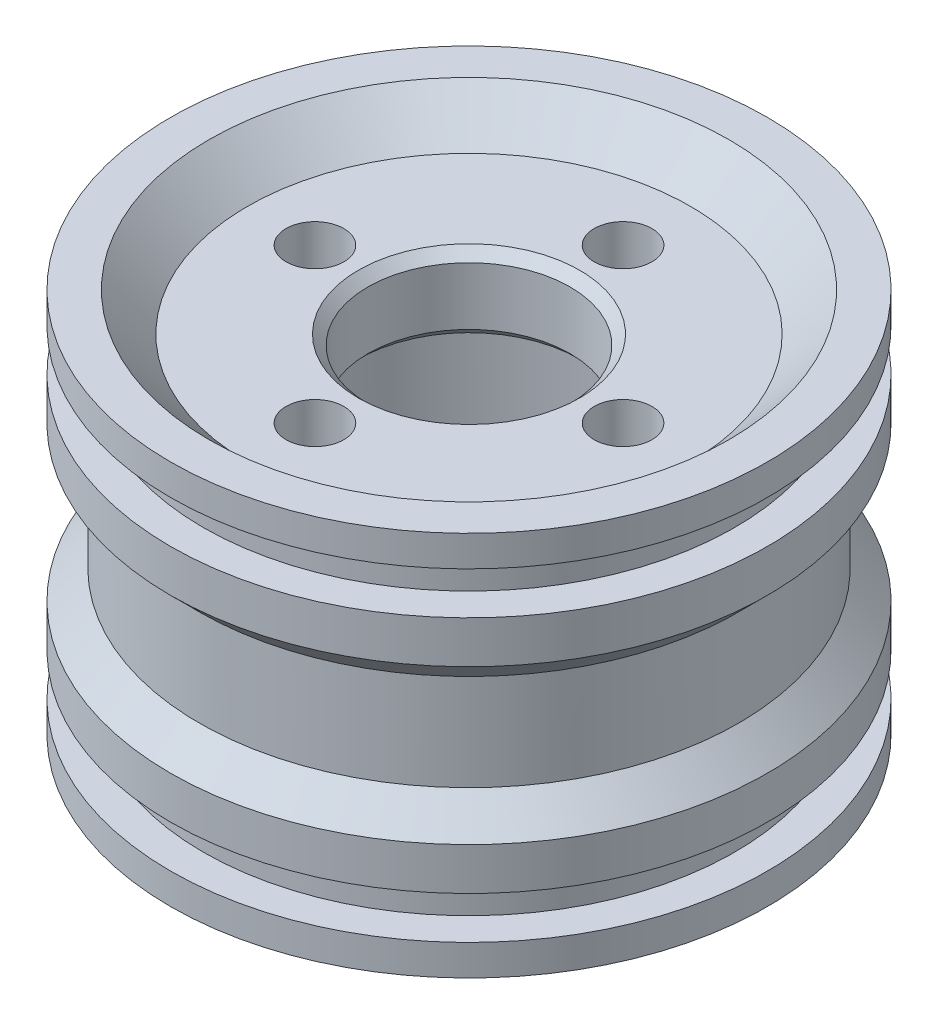
from build123d import *

# Parameters (mm, degrees)
SKETCH_1_R               = 15.5
EXTRUDE_1_DEPTH          = 10
SKETCH_2_W               = 1.7
SKETCH_2_H               = 2.2
SKETCH_4_R               = 11.5
CUT_EXTRUDE_1_DEPTH      = 14
SKETCH_5_R               = 5.25
CUT_EXTRUDE_2_DEPTH      = 15
CHAMFER_1_SIZE           = 2
CUT_EXTRUDE_START        = -2
SKETCH_6_R               = 11.5
SKETCH_6_R_2             = 5
CUT_EXTRUDE_3_DEPTH      = 2
CHAMFER_2_SIZE           = 2
SKETCH_8_R               = 1.5
CUT_EXTRUDE_4_DEPTH      = 10
PATTERN_CIRCULAR_1_COUNT = 4
SKETCH_7_W               = 1.5
SKETCH_7_H               = 8
CHAMFER_5_SIZE           = 1.5
CHAMFER_4_SIZE           = 0.5


with BuildPart() as part:
    # 草图1 → 凸台-拉伸1 (new, symmetric)
    with BuildSketch(Plane(origin=(0, 0, 0), x_dir=(1, 0, 0), z_dir=(0, 1, 0))):
        with Locations(Location((0, 0, 0), (0, 0, 270))):
            Circle(SKETCH_1_R)
    extrude(amount=EXTRUDE_1_DEPTH, both=True)

    # 草图2 → 切除-旋转1 (revolve, cut)
    with BuildSketch(Plane.XY, mode=Mode.PRIVATE) as cut_revolve_1_sk:
        with Locations((14.65, 7.3)):
            Rectangle(SKETCH_2_W, SKETCH_2_H)
    cut_revolve_1 = revolve(cut_revolve_1_sk.sketch.rotate(Axis((0, 8.4, 0), (0, -1, 0)), 90), axis=Axis((0, 8.4, 0), (0, -1, 0)), mode=Mode.SUBTRACT)

    # 镜向1: 切除-旋转1 across plane
    add(cut_revolve_1.mirror(Plane.ZX), mode=Mode.SUBTRACT)

    # 草图4 → 切除-拉伸1 (cut)
    with BuildSketch(Plane.XZ.offset(10)):
        with Locations(Location((0, 0, 0), (0, 0, 270))):
            Circle(SKETCH_4_R)
    extrude(amount=-CUT_EXTRUDE_1_DEPTH, mode=Mode.SUBTRACT)

    # 草图5 → 切除-拉伸2 (cut)
    with BuildSketch(Plane(origin=(0, 10, 0), x_dir=(1, 0, 0), z_dir=(0, 1, 0))):
        with Locations(Location((0, 0, 0), (0, 0, 270))):
            Circle(SKETCH_5_R)
    extrude(amount=-CUT_EXTRUDE_2_DEPTH, mode=Mode.SUBTRACT)

    # 倒角1
    chamfer_1_edges = [part.edges().sort_by_distance(p)[0] for p in [
        (0, -10, 11.5),
    ]]
    chamfer(chamfer_1_edges, length=CHAMFER_1_SIZE)

    # 草图6 → 切除-拉伸3 (cut)
    with BuildSketch(Plane(origin=(0, 10, 0), x_dir=(1, 0, 0), z_dir=(0, 1, 0)).offset(CUT_EXTRUDE_START)):
        with Locations(Location((0, 0, 0), (0, 0, 90))):
            Circle(SKETCH_6_R)
        Circle(SKETCH_6_R_2, mode=Mode.SUBTRACT)
    extrude(amount=CUT_EXTRUDE_3_DEPTH, mode=Mode.SUBTRACT)

    # 倒角2
    chamfer_2_edges = [part.edges().sort_by_distance(p)[0] for p in [
        (0, 10, 11.5),
    ]]
    chamfer(chamfer_2_edges, length=CHAMFER_2_SIZE - 0.0001)  # a hair under: the kernel refuses the full size

    # 草图8 → 切除-拉伸4 (cut)
    with BuildSketch(Plane.XZ.offset(-4)):
        with Locations(Location((-8, 0, 0), (0, 0, 270))):
            Circle(SKETCH_8_R)
    cut_extrude_4 = extrude(amount=-CUT_EXTRUDE_4_DEPTH, mode=Mode.SUBTRACT)

    # 阵列(圆周)1: 切除-拉伸4 ×4 about axis
    pattern_circular_1_axis = Axis((0, 0, 0), (0, 1, 0))
    for i in range(1, PATTERN_CIRCULAR_1_COUNT):
        add(cut_extrude_4.rotate(pattern_circular_1_axis, i * 360 / PATTERN_CIRCULAR_1_COUNT), mode=Mode.SUBTRACT)

    # 草图7 → 切除-旋转2 (revolve, cut)
    with BuildSketch(Plane(origin=(0, 0, 0), x_dir=(0, 0, -1), z_dir=(1, 0, 0))):
        with Locations((14.75, 0)):
            Rectangle(SKETCH_7_W, SKETCH_7_H)
    revolve(axis=Axis((0, 4, 0), (0, 1, 0)), mode=Mode.SUBTRACT)

    # 倒角5
    chamfer_5_edges = [part.edges().sort_by_distance(p)[0] for p in [
        (0, -4, 14),
        (0, 4, 14),
    ]]
    chamfer(chamfer_5_edges, length=CHAMFER_5_SIZE - 0.0001)  # a hair under: the kernel refuses the full size

    # 倒角4
    chamfer_4_edges = [part.edges().sort_by_distance(p)[0] for p in [
        (0, 4, 11.5),
        (0, 4, -5.25),
        (0, 8, -5.25),
    ]]
    chamfer(chamfer_4_edges, length=CHAMFER_4_SIZE)


solid = part.part
